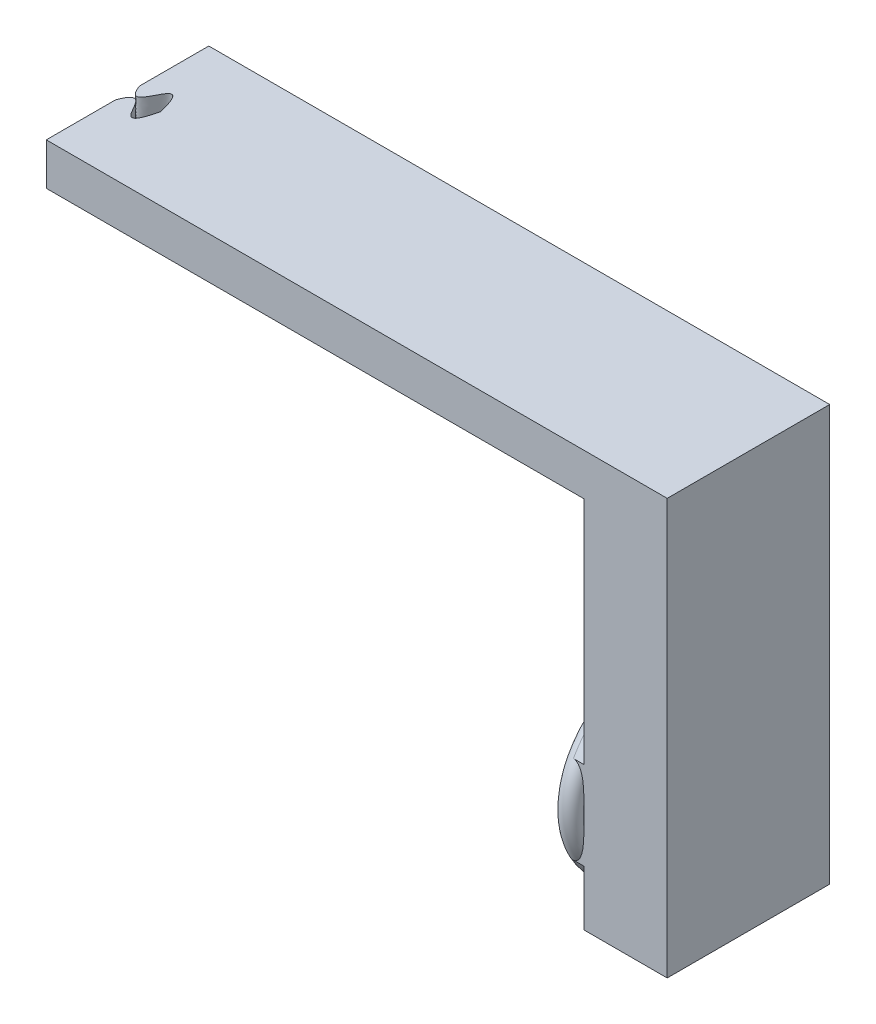
from build123d import *

# Parameters (mm, degrees)
BOSS_EXTRUDE1_DEPTH = 10
SKETCH5_W           = 19.832190572
SKETCH5_H           = 38.694970839
BOSS_EXTRUDE2_DEPTH = 88.9
SKETCH6_R           = 22
SKETCH6_R_2         = 18.35
BOSS_EXTRUDE5_DEPTH = 5
FILLET8_R           = 2.5
FILLET10_R          = 2.5


# Some blends are built 0.0001 mm under size
with BuildPart() as part:
    # Sketch1 → Boss-Extrude1 (new body)
    with BuildSketch(Plane(origin=(0, 0, 0), x_dir=(1, 0, 0), z_dir=(0, 1, 0))):
        with BuildLine():
            Line((0, 22.182836405), (0, 38.694970839))
            Line((0, 38.694970839), (147.830868253, 38.694970839))
            Line((147.830868253, 38.694970839), (147.830868253, 0))
            Line((147.830868253, 0), (0, 0))
            Line((0, 0), (0, 16.512134434))
            add(Edge.make_bspline(
                [(0, 16.512134434), (3.388756459, 25.554510726), (4.766553868, 6.635260128), (7.812405429, 19.34748542)],
                knots=[0, 0, 0, 0, 1, 1, 1, 1], degree=3))
            add(Edge.make_bspline(
                [(0, 22.182836405), (3.388756459, 13.140460113), (4.562234719, 33.060495119), (7.812405429, 19.34748542)],
                knots=[0, 0, 0, 0, 1, 1, 1, 1], degree=3))
        make_face()
    extrude(amount=BOSS_EXTRUDE1_DEPTH)

    # Sketch5 → Boss-Extrude2 (add)
    with BuildSketch(Plane.XZ):
        with Locations((137.914772967, -19.347485419)):
            Rectangle(SKETCH5_W, SKETCH5_H)
    extrude(amount=BOSS_EXTRUDE2_DEPTH)

    # Sketch6 → Boss-Extrude5 (add)
    with BuildSketch(Plane.ZY.offset(-127.998677681)):
        with Locations(Location((-19.34748542, -65.278, 0), (0, 0, 151.573820003))):
            Circle(SKETCH6_R)
        with Locations((-19.34748542, -65.278)):
            Circle(SKETCH6_R_2, mode=Mode.SUBTRACT)
    extrude(amount=BOSS_EXTRUDE5_DEPTH)

    # Fillet8
    # the kernel refuses this fillet: 2.5 mm, written as the material it takes off along each edge
    with BuildSketch(Plane(origin=(122.998677681, -65.278, -19.34748542), x_dir=(0, 0.4760260947170219, -0.8794311554342733), z_dir=(0, 0.8794311554342733, 0.4760260947170219))) as fillet8_piece_1:
        with BuildLine():
            CenterArc((22 - FILLET8_R, -FILLET8_R), FILLET8_R, 0, 90)
            Line((22 - FILLET8_R, 0), (22, 0))
            Line((22, 0), (22, -FILLET8_R))
        make_face()
    revolve(axis=Axis((122.998677681, -65.278, -19.34748542), (-1, 0, 0)), mode=Mode.SUBTRACT)
    with BuildSketch(Plane(origin=(127.998677681, -65.278, -19.34748542), x_dir=(0, -0.7034691190214044, 0.7107258251838392), z_dir=(0, -0.7107258251838392, -0.7034691190214044))) as fillet8_piece_2_section:
        with BuildLine():
            CenterArc((22 - FILLET8_R, FILLET8_R), FILLET8_R, 270, 90)
            Line((22 - FILLET8_R, 0), (22, 0))
            Line((22, 0), (22, FILLET8_R))
        make_face()
    fillet8_piece_2 = revolve(axis=Axis((127.998677681, -65.278, -19.34748542), (-1, 0, 0)), revolution_arc=89.411997633, mode=Mode.PRIVATE)
    fillet8_piece_2 = split(fillet8_piece_2, bisect_by=Plane(origin=(127.287251046, -65.278, 0), z_dir=(0, 0, 1)), keep=Keep.TOP, mode=Mode.PRIVATE)
    add(fillet8_piece_2, mode=Mode.SUBTRACT)

    # Fillet10
    fillet10_edges = [part.edges().sort_by_distance(p)[0] for p in [
        (127.998677681, -65.278, -41.34748542),
    ]]
    fillet(fillet10_edges, radius=FILLET10_R - 0.0001)  # a hair under: the kernel refuses the full size


solid = part.part
